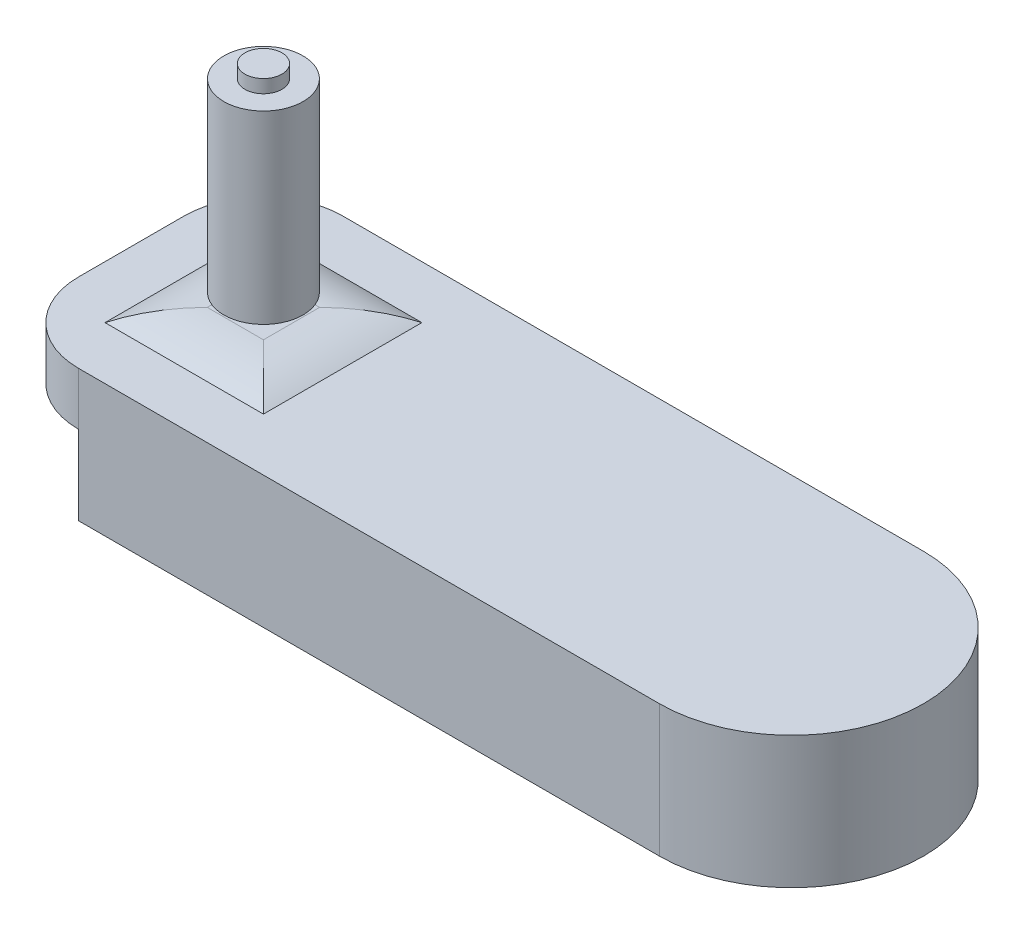
from build123d import *

# Parameters (mm, degrees)
SKETCH1_W           = 381
SKETCH1_H           = 127
BOSS_EXTRUDE1_DEPTH = 25.4
FILLET1_R           = 63.5
FILLET2_R           = 38.1
BOSS_EXTRUDE2_DEPTH = 25.4
BOSS_EXTRUDE3_DEPTH = 12.7
SKETCH4_W           = 76.2
SKETCH4_H           = 76.2
BOSS_EXTRUDE4_DEPTH = 6.35
FILLET3_R           = 50.8
SKETCH5_R           = 8.89
BOSS_EXTRUDE5_DEPTH = 6.35
SKETCH6_R           = 19.05
BOSS_EXTRUDE6_DEPTH = 88.9
CUT_EXTRUDE1_DEPTH  = 88.9
SKETCH8_R           = 8.89
BOSS_EXTRUDE7_DEPTH = 6.35
CUT_EXTRUDE2_START  = -12.7
CUT_EXTRUDE2_DEPTH  = 12.7
SKETCH10_R          = 5.08
CUT_EXTRUDE3_DEPTH  = 95.25


# Some blends are built 0.0001 mm under size
with BuildPart() as part:
    # Sketch1 → Boss-Extrude1 (new body)
    with BuildSketch(Plane(origin=(0, 0, 0), x_dir=(1, 0, 0), z_dir=(0, 1, 0))):
        with Locations((-190.5, -63.5)):
            Rectangle(SKETCH1_W, SKETCH1_H)
    extrude(amount=BOSS_EXTRUDE1_DEPTH)

    # Fillet1
    fillet1_edges = [part.edges().sort_by_distance(p)[0] for p in [
        (0, 12.7, 0),
        (0, 12.7, 127),
    ]]
    fillet(fillet1_edges, radius=FILLET1_R - 0.0001)  # a hair under: the kernel refuses the full size

    # Fillet2
    fillet2_edges = [part.edges().sort_by_distance(p)[0] for p in [
        (-381, 12.7, 127),
        (-381, 12.7, 0),
    ]]
    fillet(fillet2_edges, radius=FILLET2_R)

    # Sketch2 → Boss-Extrude2 (add)
    with BuildSketch(Plane(origin=(0, 0, 0), x_dir=(1, 0, 0), z_dir=(0, 1, 0))):
        with BuildLine():
            Line((-63.5, -12.7), (-342.9, -11.159231637))
            Line((-342.9, -11.159231637), (-342.9, 0))
            Line((-342.9, 0), (-63.5, 0))
            ThreePointArc((-63.5, 0), (0, -63.5), (-63.5, -127))
            Line((-63.5, -127), (-342.9, -127))
            Line((-342.9, -127), (-342.9, -114.3))
            Line((-342.9, -114.3), (-63.5, -114.3))
            ThreePointArc((-63.5, -114.3), (-12.7, -63.5), (-63.5, -12.7))
        make_face()
    extrude(amount=-BOSS_EXTRUDE2_DEPTH)

    # Sketch3 → Boss-Extrude3 (add)
    with BuildSketch(Plane(origin=(0, -25.4, 0), x_dir=(1, 0, 0), z_dir=(0, 1, 0))):
        with BuildLine():
            Line((-342.9, -127), (-342.9, -82.55))
            Line((-342.9, -82.55), (-63.5, -82.55))
            ThreePointArc((-63.5, -82.55), (-44.45, -63.5), (-63.5, -44.45))
            Line((-63.5, -44.45), (-342.9, -44.45))
            Line((-342.9, -44.45), (-342.9, 0))
            Line((-342.9, 0), (-63.5, 0))
            ThreePointArc((-63.5, 0), (0, -63.5), (-63.5, -127))
            Line((-63.5, -127), (-342.9, -127))
        make_face()
    extrude(amount=-BOSS_EXTRUDE3_DEPTH)

    # Sketch4 → Boss-Extrude4 (add)
    with BuildSketch(Plane(origin=(0, 25.4, 0), x_dir=(1, 0, 0), z_dir=(0, 1, 0))):
        with Locations((-317.5, -63.5)):
            Rectangle(SKETCH4_W, SKETCH4_H)
    extrude(amount=BOSS_EXTRUDE4_DEPTH)

    # Fillet3
    # the kernel refuses this fillet: 50.8 mm, written as the material it takes off along each edge
    with BuildSketch(Plane(origin=(-279.4, 31.75, 163.083610621), x_dir=(0, -1, 0), z_dir=(0, 0, -1)), Plane(origin=(-417.083610621, 31.75, 101.6), x_dir=(0, -1, 0), z_dir=(1, 0, 0)), Plane(origin=(-355.6, 31.75, -36.083610621), x_dir=(0, -1, 0), z_dir=(0, 0, 1)), Plane(origin=(-217.916389379, 31.75, 25.4), x_dir=(0, -1, 0), z_dir=(-1, 0, 0))) as fillet3_piece_1:
        with BuildLine():
            CenterArc((50.8, 24.593444248), FILLET3_R, 180, 28.955024372)
            Line((0, 24.593444248), (-1.016, 24.593444248))
            Line((-1.016, 24.593444248), (-1.016, 0))
            Line((-1.016, 0), (0, -1.016))
            ThreePointArc((0, -1.016), (3.175, -1.016), (5.461, -0.491868885))
            Line((5.461, -0.491868885), (6.35, 0))
        make_face()
    extrude(amount=199.167221242, mode=Mode.SUBTRACT)

    # Sketch5 → Boss-Extrude5 (add)
    with BuildSketch(Plane(origin=(0, 31.75, 0), x_dir=(1, 0, 0), z_dir=(0, 1, 0))):
        with Locations(Location((-317.5, -63.5, 0), (0, 0, 90))):
            Circle(SKETCH5_R)
    extrude(amount=BOSS_EXTRUDE5_DEPTH)

    # Sketch6 → Boss-Extrude6 (add)
    with BuildSketch(Plane(origin=(0, 38.1, 0), x_dir=(1, 0, 0), z_dir=(0, 1, 0))):
        with Locations(Location((-317.5, -63.5, 0), (0, 0, 270))):
            Circle(SKETCH6_R)
    extrude(amount=BOSS_EXTRUDE6_DEPTH)

    # Sketch7 → Cut-Extrude1 (cut)
    with BuildSketch(Plane.XY):
        with BuildLine():
            Line((-336.55, 127), (-336.55, 124.46))
            ThreePointArc((-336.55, 124.46), (-332.607071488, 114.940928512), (-336.55, 105.421857023))
            Line((-336.55, 105.421857023), (-336.55, 105.41))
            Line((-336.55, 105.41), (-336.55, 102.87))
            ThreePointArc((-336.55, 102.87), (-332.607071488, 93.350928512), (-336.55, 83.831857023))
            Line((-336.55, 83.831857023), (-336.55, 83.82))
            Line((-336.55, 83.82), (-336.55, 81.28))
            ThreePointArc((-336.55, 81.28), (-332.607071488, 71.760928512), (-336.55, 62.241857023))
            Line((-336.55, 62.241857023), (-336.55, 62.23))
            Line((-336.55, 62.23), (-336.55, 59.69))
            ThreePointArc((-336.55, 59.69), (-332.607071488, 50.170928512), (-336.55, 40.651857023))
            Line((-336.55, 40.651857023), (-336.55, 40.64))
            Line((-336.55, 40.64), (-368.013875858, 40.64))
            Line((-368.013875858, 40.64), (-368.013875858, 127.710007378))
            Line((-368.013875858, 127.710007378), (-336.55, 127))
        make_face()
    extrude(amount=CUT_EXTRUDE1_DEPTH, mode=Mode.SUBTRACT)

    # Sketch8 → Boss-Extrude7 (add)
    with BuildSketch(Plane(origin=(0, 127, 0), x_dir=(1, 0, 0), z_dir=(0, 1, 0))):
        with Locations(Location((-317.5, -63.5, 0), (0, 0, 90))):
            Circle(SKETCH8_R)
    extrude(amount=BOSS_EXTRUDE7_DEPTH)

    # Sketch9 → Cut-Extrude2 (cut)
    with BuildSketch(Plane.XZ.offset(CUT_EXTRUDE2_START)):
        with BuildLine():
            Line((-342.9, 82.55), (-63.5, 82.55))
            ThreePointArc((-63.5, 82.55), (-44.45, 63.5), (-63.5, 44.45))
            Line((-63.5, 44.45), (-342.9, 44.45))
            Line((-342.9, 44.45), (-342.9, 82.55))
        make_face()
    extrude(amount=CUT_EXTRUDE2_DEPTH, mode=Mode.SUBTRACT)

    # Sketch10 → Cut-Extrude3 (cut)
    with BuildSketch(Plane.XZ.offset(-12.7)):
        with Locations(Location((-317.5, 63.5, 0), (0, 0, 270))):
            Circle(SKETCH10_R)
    extrude(amount=-CUT_EXTRUDE3_DEPTH, mode=Mode.SUBTRACT)


solid = part.part
